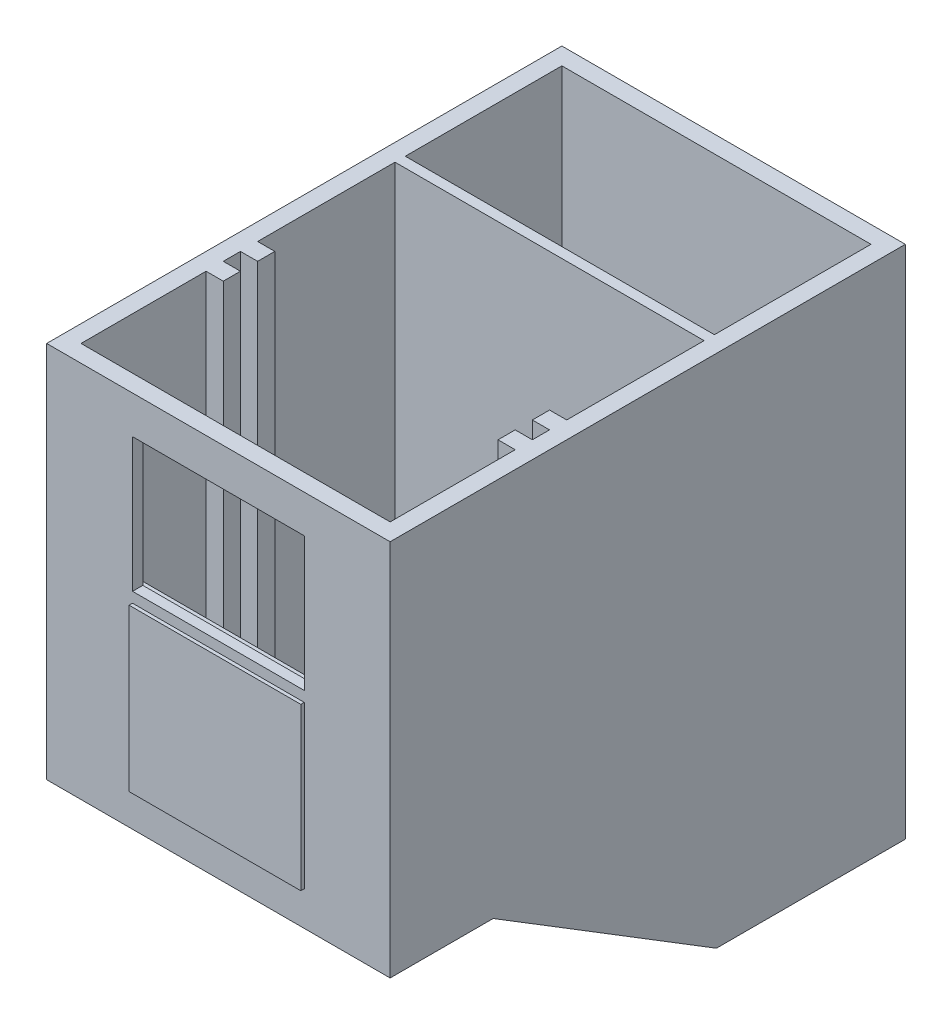
from build123d import *

# Parameters (mm, degrees)
SKETCH1_W           = 100
SKETCH1_H           = 150
BOSS_EXTRUDE1_DEPTH = 150
CUT_EXTRUDE7_REACH  = 197.256
SHELL1_T            = -5
CUT_EXTRUDE2_REACH  = 177
SKETCH3_R           = 4
SKETCH3_R_2         = 1.5
SKETCH5_W           = 50
SKETCH5_H           = 47
BOSS_EXTRUDE3_DEPTH = 1
CUT_EXTRUDE3_REACH  = 219.945
SKETCH8_W           = 50
SKETCH8_H           = 39
BOSS_EXTRUDE5_REACH = 177.431
SKETCH16_W          = 5
SKETCH16_H          = 5
SKETCH18_W          = 56
SKETCH18_H          = 41
CUT_EXTRUDE9_DEPTH  = 2
CUT_EXTRUDE10_START = -4
SKETCH20_W          = 46
SKETCH20_H          = 45
CUT_EXTRUDE10_DEPTH = 15
SKETCH21_W          = 18
SKETCH21_H          = 15
CUT_EXTRUDE11_DEPTH = 2.5
BOSS_EXTRUDE6_REACH = 195.135
SKETCH22_W          = 3
SKETCH22_H          = 145


with BuildPart() as part:
    # Sketch1 → Boss-Extrude1 (new body)
    with BuildSketch(Plane(origin=(0, 0, 0), x_dir=(1, 0, 0), z_dir=(0, 1, 0))):
        Rectangle(SKETCH1_W, SKETCH1_H)
    extrude(amount=BOSS_EXTRUDE1_DEPTH)

    # Sketch13 → Cut-Extrude7 (cut, up to next)
    with BuildSketch(Plane(origin=(50, 0, 0), x_dir=(0, 0, -1), z_dir=(1, 0, 0)), mode=Mode.PRIVATE) as cut_extrude7_sk1:
        Polygon((-45, 40), (20, 0), (-45, 0), (-75, 0), (-75, 40), align=None)
    cut_extrude7_tool1 = extrude(cut_extrude7_sk1.sketch, amount=-CUT_EXTRUDE7_REACH, mode=Mode.PRIVATE) & part.part
    add(cut_extrude7_tool1.solids().sort_by_distance((50, 16.533333, 40.933333))[0], mode=Mode.SUBTRACT)

    # Shell1
    shell1_openings = [part.faces().sort_by_distance(p)[0] for p in [
        (0, 150, 0),
    ]]
    offset(amount=SHELL1_T, openings=shell1_openings, kind=Kind.INTERSECTION)

    # Sketch3 → Cut-Extrude2 (cut, up to next)
    with BuildSketch(Plane.XZ, mode=Mode.PRIVATE) as cut_extrude2_sk1:
        with Locations((0, 60)):
            Circle(SKETCH3_R)
    cut_extrude2_tool1 = extrude(cut_extrude2_sk1.sketch, amount=-CUT_EXTRUDE2_REACH, mode=Mode.PRIVATE) & part.part
    # Sketch3 → Cut-Extrude2 (cut, up to next)
    with BuildSketch(Plane.XZ, mode=Mode.PRIVATE) as cut_extrude2_sk2:
        with Locations((-5, 50)):
            Circle(SKETCH3_R_2)
    cut_extrude2_tool2 = extrude(cut_extrude2_sk2.sketch, amount=-CUT_EXTRUDE2_REACH, mode=Mode.PRIVATE) & part.part
    # Sketch3 → Cut-Extrude2 (cut, up to next)
    with BuildSketch(Plane.XZ, mode=Mode.PRIVATE) as cut_extrude2_sk3:
        with Locations((5, 50)):
            Circle(SKETCH3_R_2)
    cut_extrude2_tool3 = extrude(cut_extrude2_sk3.sketch, amount=-CUT_EXTRUDE2_REACH, mode=Mode.PRIVATE) & part.part
    add(cut_extrude2_tool1.solids().sort_by_distance((0, 0, 60))[0], mode=Mode.SUBTRACT)
    add(cut_extrude2_tool2.solids().sort_by_distance((-5, 0, 50))[0], mode=Mode.SUBTRACT)
    add(cut_extrude2_tool3.solids().sort_by_distance((5, 0, 50))[0], mode=Mode.SUBTRACT)

    # Sketch5 → Boss-Extrude3 (add)
    with BuildSketch(Plane.XY.offset(75)):
        with Locations((0, 73.5)):
            Rectangle(SKETCH5_W, SKETCH5_H)
    extrude(amount=BOSS_EXTRUDE3_DEPTH)

    # Sketch8 → Cut-Extrude3 (cut, up to next)
    with BuildSketch(Plane.XY.offset(75), mode=Mode.PRIVATE) as cut_extrude3_sk1:
        with Locations((0, 119.5)):
            Rectangle(SKETCH8_W, SKETCH8_H)
    cut_extrude3_tool1 = extrude(cut_extrude3_sk1.sketch, amount=-CUT_EXTRUDE3_REACH, mode=Mode.PRIVATE) & part.part
    add(cut_extrude3_tool1.solids().sort_by_distance((0, 119.5, 75))[0], mode=Mode.SUBTRACT)

    # Sketch16 → Boss-Extrude5 (add, up to next)
    with BuildSketch(Plane(origin=(0, 150, 0), x_dir=(1, 0, 0), z_dir=(0, 1, 0)), mode=Mode.PRIVATE) as boss_extrude5_sk1:
        with Locations((42.5, -21.084789048)):
            Rectangle(SKETCH16_W, SKETCH16_H)
    boss_extrude5_tool1 = extrude(boss_extrude5_sk1.sketch, amount=-BOSS_EXTRUDE5_REACH, mode=Mode.PRIVATE) - part.part
    # Sketch16 → Boss-Extrude5 (add, up to next)
    with BuildSketch(Plane(origin=(0, 150, 0), x_dir=(1, 0, 0), z_dir=(0, 1, 0)), mode=Mode.PRIVATE) as boss_extrude5_sk2:
        with Locations((42.5, -31.084789048)):
            Rectangle(SKETCH16_W, SKETCH16_H)
    boss_extrude5_tool2 = extrude(boss_extrude5_sk2.sketch, amount=-BOSS_EXTRUDE5_REACH, mode=Mode.PRIVATE) - part.part
    boss_extrude5_1 = boss_extrude5_tool1.solids().sort_by_distance((42.5, 150, 21.084789))[0]
    add(boss_extrude5_1)
    boss_extrude5_2 = boss_extrude5_tool2.solids().sort_by_distance((42.5, 150, 31.084789))[0]
    add(boss_extrude5_2)
    boss_extrude5 = boss_extrude5_1 + boss_extrude5_2  # Boss-Extrude5 as one shape, for the pattern or mirror that repeats it

    # Mirror1: Boss-Extrude5 across plane
    add(boss_extrude5.mirror(Plane(origin=(0, 0, 0), x_dir=(0, 0, 1), z_dir=(1, 0, 0))))

    # Sketch18 → Cut-Extrude9 (cut)
    with BuildSketch(Plane(origin=(0, 0, 70), x_dir=(-1, 0, 0), z_dir=(0, 0, -1))):
        with Locations((2, 119.5)):
            Rectangle(SKETCH18_W, SKETCH18_H)
    extrude(amount=-CUT_EXTRUDE9_DEPTH, mode=Mode.SUBTRACT)

    # Sketch20 → Cut-Extrude10 (cut)
    with BuildSketch(Plane.XY.offset(76).offset(CUT_EXTRUDE10_START)):
        with Locations((0, 73.5)):
            Rectangle(SKETCH20_W, SKETCH20_H)
    extrude(amount=-CUT_EXTRUDE10_DEPTH, mode=Mode.SUBTRACT)

    # Sketch21 → Cut-Extrude11 (cut)
    with BuildSketch(Plane(origin=(0, 45, 0), x_dir=(1, 0, 0), z_dir=(0, 1, 0))):
        with Locations((0, -45)):
            Rectangle(SKETCH21_W, SKETCH21_H)
    extrude(amount=-CUT_EXTRUDE11_DEPTH, mode=Mode.SUBTRACT)

    # Sketch22 → Boss-Extrude6 (add, up to next)
    with BuildSketch(Plane(origin=(-45, 0, 0), x_dir=(0, 0, -1), z_dir=(1, 0, 0)), mode=Mode.PRIVATE) as boss_extrude6_sk1:
        with Locations((22.915210952, 77.5)):
            Rectangle(SKETCH22_W, SKETCH22_H)
    boss_extrude6_tool1 = extrude(boss_extrude6_sk1.sketch, amount=BOSS_EXTRUDE6_REACH, mode=Mode.PRIVATE) - part.part
    add(boss_extrude6_tool1.solids().sort_by_distance((-45, 77.5, -22.915211))[0])


solid = part.part
